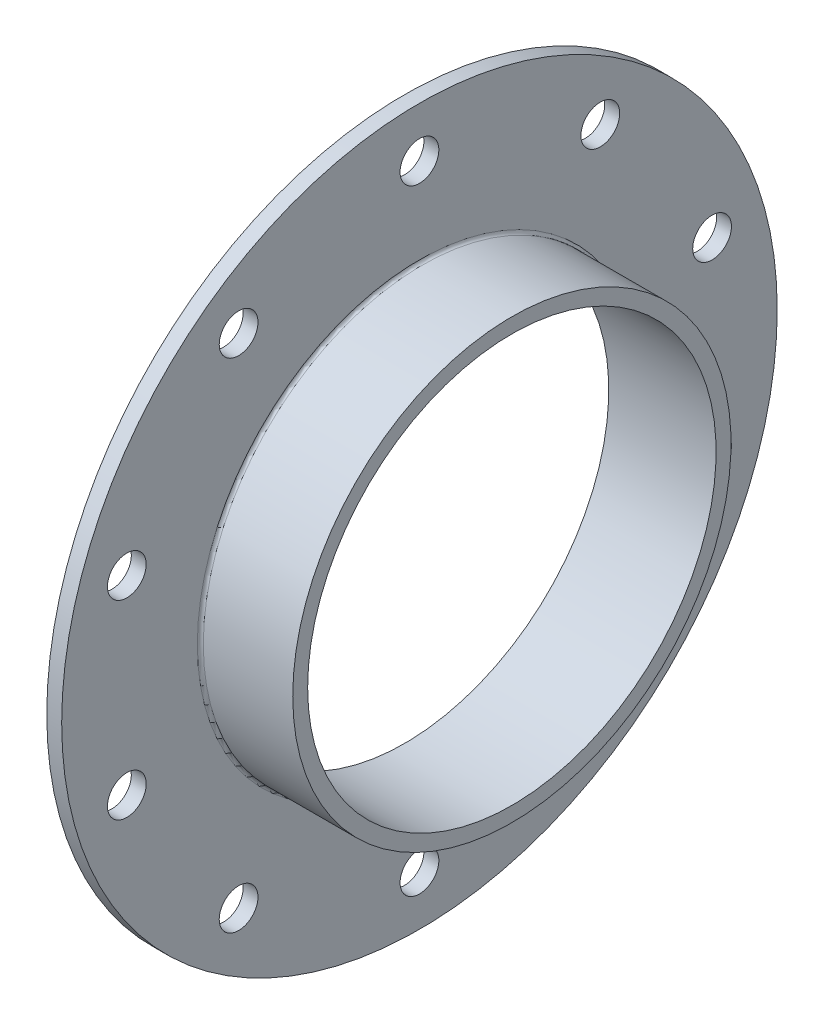
from build123d import *

# Parameters (mm, degrees)
SKETCH4_R          = 3.25
CUT_EXTRUDE1_DEPTH = 10
FILLET2_R          = 0.5


with BuildPart() as part:
    # Sketch3 → Revolve1 (revolve)
    with BuildSketch(Plane.XY):
        Polygon((0, 34.25), (0, 60), (2.5, 60), (2.5, 36.75), (18, 36.75), (18, 34.25), align=None)
    revolve(axis=Axis((0, 0, 0), (1, 0, 0)))

    # Sketch4 → Cut-Extrude1 (cut)
    with BuildSketch(Plane.ZY):
        with Locations((30.329719018, 41.74527691)):
            Circle(SKETCH4_R)
        with Locations((0, 51.6)):
            Circle(SKETCH4_R)
        with Locations((49.074516241, 15.94527691)):
            Circle(SKETCH4_R)
        with Locations((49.074516241, -15.94527691)):
            Circle(SKETCH4_R)
        with Locations((30.329719018, -41.74527691)):
            Circle(SKETCH4_R)
        with Locations((0, -51.6)):
            Circle(SKETCH4_R)
        with Locations((-30.329719018, -41.74527691)):
            Circle(SKETCH4_R)
        with Locations((-49.074516241, -15.94527691)):
            Circle(SKETCH4_R)
        with Locations((-49.074516241, 15.94527691)):
            Circle(SKETCH4_R)
        with Locations((-30.329719018, 41.74527691)):
            Circle(SKETCH4_R)
    extrude(amount=-CUT_EXTRUDE1_DEPTH, mode=Mode.SUBTRACT)

    # Fillet2
    fillet2_edges = [part.edges().sort_by_distance(p)[0] for p in [
        (2.5, -36.75, 0),
    ]]
    fillet(fillet2_edges, radius=FILLET2_R)


solid = part.part
